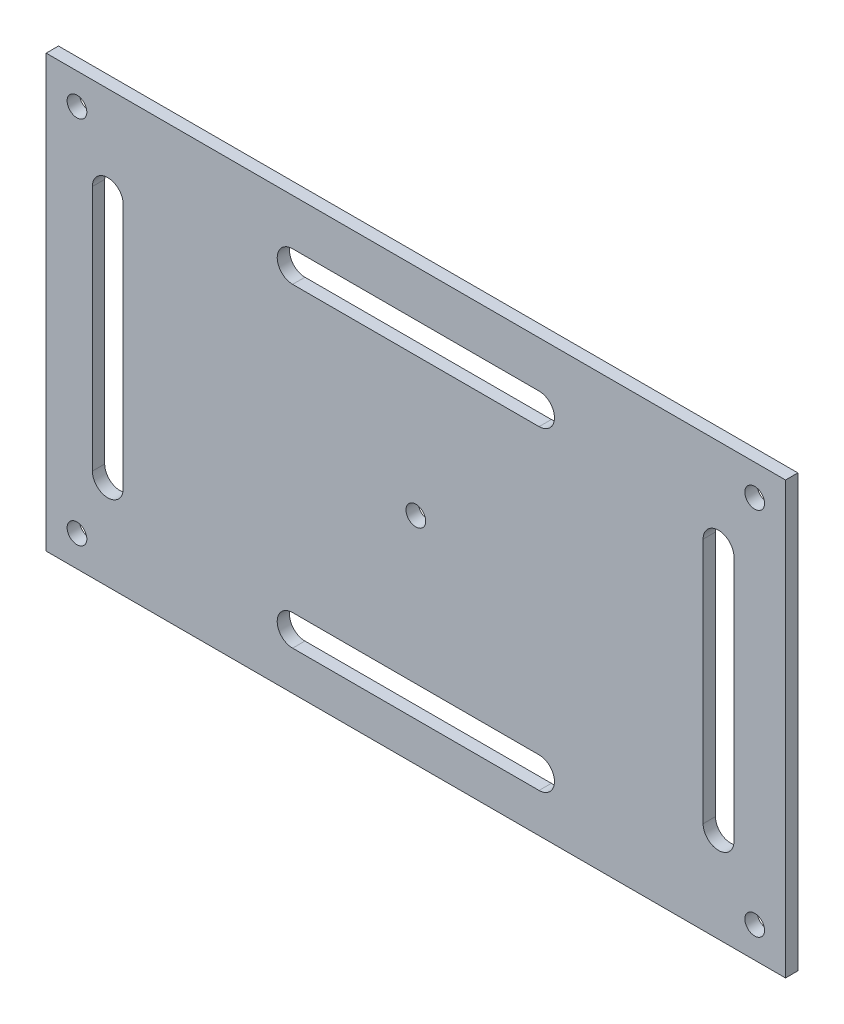
from build123d import *

# Parameters (mm, degrees)
SKETCH1_W           = 120
SKETCH1_H           = 70
SKETCH1_R           = 1.6
BOSS_EXTRUDE1_DEPTH = 2


with BuildPart() as part:
    # Sketch1 → Boss-Extrude1 (new body)
    with BuildSketch(Plane.XY):
        Rectangle(SKETCH1_W, SKETCH1_H)
        with BuildLine():
            ThreePointArc((-53.4, -30), (-56.13137085, -31.13137085), (-55, -28.4))
            ThreePointArc((-55, -28.4), (-53.86862915, -28.86862915), (-53.4, -30))
        make_face(mode=Mode.SUBTRACT)
        with BuildLine():
            ThreePointArc((-52.5, 20), (-50, 22.5), (-47.5, 20))
            Line((-47.5, 20), (-47.5, -20))
            ThreePointArc((-47.5, -20), (-50, -22.5), (-52.5, -20))
            Line((-52.5, -20), (-52.5, 20))
        make_face(mode=Mode.SUBTRACT)
        Circle(SKETCH1_R, mode=Mode.SUBTRACT)
        with BuildLine():
            ThreePointArc((-20, -28.636211525), (-22.5, -26.136211525), (-20, -23.636211525))
            Line((-20, -23.636211525), (20, -23.636211525))
            ThreePointArc((20, -23.636211525), (22.5, -26.136211525), (20, -28.636211525))
            Line((20, -28.636211525), (-20, -28.636211525))
        make_face(mode=Mode.SUBTRACT)
        with BuildLine():
            ThreePointArc((56.6, -30), (55, -31.6), (53.4, -30))
            ThreePointArc((53.4, -30), (53.86862915, -28.86862915), (55, -28.4))
            ThreePointArc((55, -28.4), (56.13137085, -28.86862915), (56.6, -30))
        make_face(mode=Mode.SUBTRACT)
        with BuildLine():
            ThreePointArc((-55, 28.4), (-56.13137085, 31.13137085), (-53.4, 30))
            ThreePointArc((-53.4, 30), (-53.86862915, 28.86862915), (-55, 28.4))
        make_face(mode=Mode.SUBTRACT)
        with BuildLine():
            ThreePointArc((46.628871571, 20), (49.128871571, 22.5), (51.628871571, 20))
            Line((51.628871571, 20), (51.628871571, -20))
            ThreePointArc((51.628871571, -20), (49.128871571, -22.5), (46.628871571, -20))
            Line((46.628871571, -20), (46.628871571, 20))
        make_face(mode=Mode.SUBTRACT)
        with BuildLine():
            ThreePointArc((-20, 22.5), (-22.5, 25), (-20, 27.5))
            Line((-20, 27.5), (20, 27.5))
            ThreePointArc((20, 27.5), (22.5, 25), (20, 22.5))
            Line((20, 22.5), (-20, 22.5))
        make_face(mode=Mode.SUBTRACT)
        with BuildLine():
            ThreePointArc((55, 28.4), (53.86862915, 28.86862915), (53.4, 30))
            ThreePointArc((53.4, 30), (55, 31.6), (56.6, 30))
            ThreePointArc((56.6, 30), (56.13137085, 28.86862915), (55, 28.4))
        make_face(mode=Mode.SUBTRACT)
    extrude(amount=BOSS_EXTRUDE1_DEPTH)


solid = part.part
